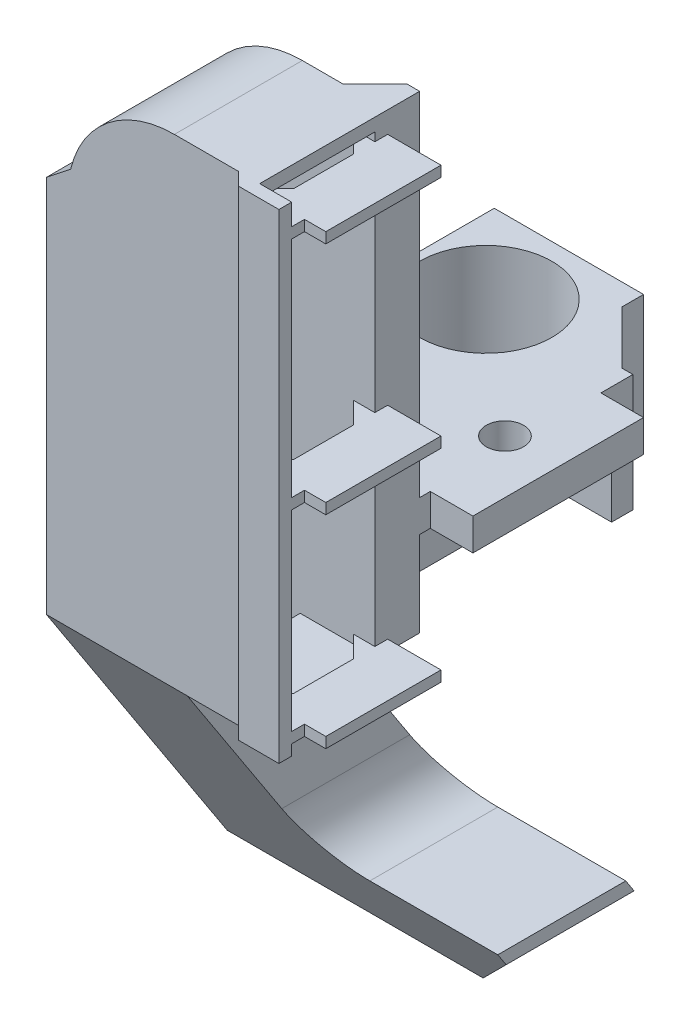
from build123d import *

# Parameters (mm, degrees)
BOSS_EXTRUDE1_DEPTH       = 12
SHELL1_T                  = -1.2
SHELL1_THICKNESS_2_FACE_W = 43.8
SHELL1_THICKNESS_2_FACE_H = 9.6
SHELL1_THICKNESS_2_DEPTH  = 5.8
SKETCH2_W                 = 9.6
SKETCH2_H                 = 42.6
CUT_EXTRUDE2_DEPTH        = 7
BOSS_EXTRUDE3_REACH       = 49.634
SKETCH3_W                 = 5
SKETCH3_H                 = 1
BOSS_EXTRUDE4_DEPTH       = 11.2
SHELL2_START              = -8.8
SHELL2_DEPTH              = 8.8
CUT_EXTRUDE3_REACH        = 50.88
FILLET1_R                 = 10
BOSS_EXTRUDE5_DEPTH       = 17
SKETCH7_W                 = 5
SKETCH7_H                 = 45
BOSS_EXTRUDE6_DEPTH       = 1.2
SKETCH8_W                 = 1.2
SKETCH8_H                 = 45
BOSS_EXTRUDE7_DEPTH       = 3
CHAMFER1_SIZE             = 1.2
CHAMFER2_SIZE             = 3
CHAMFER3_SIZE             = 2
SKETCH9_W                 = 1.2
SKETCH9_H                 = 45
CUT_EXTRUDE4_DEPTH        = 2
CUT_EXTRUDE6_REACH        = 58.138
BOSS_EXTRUDE10_DEPTH      = 12
CUT_EXTRUDE8_DEPTH        = 10
CUT_EXTRUDE9_REACH        = 50.002
SKETCH20_R                = 1.75
BOSS_EXTRUDE11_DEPTH      = 12
CUT_EXTRUDE10_REACH       = 53.723
SKETCH22_R                = 6.2
CHAMFER4_SIZE             = 5
BOSS_EXTRUDE12_DEPTH      = 2
CHAMFER6_SIZE             = 5
CHAMFER6_SIZE2            = 3.613034268
FILLET2_R                 = 5


# Read off the part's stored shape, not the designer's step: Shell2
# Some blends are built 0.0001 mm under size
with BuildPart() as part:
    # Sketch1 → Boss-Extrude1 (new body)
    with BuildSketch(Plane.XY):
        with BuildLine():
            Line((-10, 0), (-10, 35))
            ThreePointArc((-10, 35), (-7.071067812, 42.071067812), (0, 45))
            Line((0, 45), (8, 45))
            Line((8, 45), (8, 0))
            Line((8, 0), (0, 0))
            Line((0, 0), (-10, 0))
        make_face()
    extrude(amount=BOSS_EXTRUDE1_DEPTH)

    # Shell1
    shell1_openings = [part.faces().sort_by_distance(p)[0] for p in [
        (-1, 0, 6),
    ]]
    offset(amount=SHELL1_T, openings=shell1_openings, kind=Kind.INTERSECTION)

    # Shell1 thickness 2 face (on inner face of the shell) → Shell1 thickness 2 (add)
    with BuildSketch(Plane(origin=(6.8, 21.9, 6), x_dir=(0, 1, 0), z_dir=(1, 0, 0))):
        Rectangle(SHELL1_THICKNESS_2_FACE_W, SHELL1_THICKNESS_2_FACE_H)
    extrude(amount=-SHELL1_THICKNESS_2_DEPTH)

    # Sketch2 → Cut-Extrude2 (cut)
    with BuildSketch(Plane(origin=(8, 0, 0), x_dir=(0, 0, -1), z_dir=(1, 0, 0))):
        with Locations((-6, 22.5)):
            Rectangle(SKETCH2_W, SKETCH2_H)
    extrude(amount=-CUT_EXTRUDE2_DEPTH, mode=Mode.SUBTRACT)

    # Boss-Extrude3: up to this face of the body (flat: up to its plane)
    boss_extrude3_end = Plane(part.part.faces().sort_by_distance((-0.815853962, 21.94845022, 0))[0])
    # Sketch3 → Boss-Extrude3 (add, up to the picked face)
    with BuildSketch(Plane.XY.offset(12), mode=Mode.PRIVATE) as boss_extrude3_sk1:
        with Locations((10.5, 1.5)):
            Rectangle(SKETCH3_W, SKETCH3_H)
    boss_extrude3_tool1 = split(extrude(boss_extrude3_sk1.sketch, amount=-BOSS_EXTRUDE3_REACH, mode=Mode.PRIVATE), bisect_by=boss_extrude3_end, keep=Keep.BOTH, mode=Mode.PRIVATE)
    # Sketch3 → Boss-Extrude3 (add, up to the picked face)
    with BuildSketch(Plane.XY.offset(12), mode=Mode.PRIVATE) as boss_extrude3_sk2:
        with Locations((10.5, 42.5)):
            Rectangle(SKETCH3_W, SKETCH3_H)
    boss_extrude3_tool2 = split(extrude(boss_extrude3_sk2.sketch, amount=-BOSS_EXTRUDE3_REACH, mode=Mode.PRIVATE), bisect_by=boss_extrude3_end, keep=Keep.BOTH, mode=Mode.PRIVATE)
    # Sketch3 → Boss-Extrude3 (add, up to the picked face)
    with BuildSketch(Plane.XY.offset(12), mode=Mode.PRIVATE) as boss_extrude3_sk3:
        with Locations((10.5, 20.5)):
            Rectangle(SKETCH3_W, SKETCH3_H)
    boss_extrude3_tool3 = split(extrude(boss_extrude3_sk3.sketch, amount=-BOSS_EXTRUDE3_REACH, mode=Mode.PRIVATE), bisect_by=boss_extrude3_end, keep=Keep.BOTH, mode=Mode.PRIVATE)
    add(boss_extrude3_tool1.solids().sort_by(Axis((10.5, 1.5, 12), (0, 0, -1)))[0])
    add(boss_extrude3_tool2.solids().sort_by(Axis((10.5, 42.5, 12), (0, 0, -1)))[0])
    add(boss_extrude3_tool3.solids().sort_by(Axis((10.5, 20.5, 12), (0, 0, -1)))[0])

    # Sketch4 → Boss-Extrude4 (add)
    with BuildSketch(Plane.ZY.offset(10)):
        Polygon((0, 0), (-15, -23), (-15, -26), (-4.956521739, -26), (12, 0), align=None)
    extrude(amount=-BOSS_EXTRUDE4_DEPTH)

    # Shell2 outline → Shell2 (cut)
    with BuildSketch(Plane.YZ.offset(SHELL2_START)):
        Polygon((-24.8, -13.8), (-23.356724835, -13.8), (-0.356724835, 1.2), (0, 1.2), (0, 10.567353369), (-24.8, -5.606559675), align=None)
    extrude(amount=SHELL2_DEPTH, mode=Mode.SUBTRACT)

    # Sketch5 → Cut-Extrude3 (cut, up to next)
    with BuildSketch(Plane(origin=(1.2, 0, 0), x_dir=(0, 0, -1), z_dir=(1, 0, 0)), mode=Mode.PRIVATE) as cut_extrude3_sk1:
        Polygon((2.34569011, -19.8), (11.480396847, -19.8), (13.8, -23.356724835), (13.8, -24.8), (5.606559675, -24.8), align=None)
    cut_extrude3_tool1 = extrude(cut_extrude3_sk1.sketch, amount=-CUT_EXTRUDE3_REACH, mode=Mode.PRIVATE) & part.part
    add(cut_extrude3_tool1.solids().sort_by_distance((1.2, -22.269522, -8.459387))[0], mode=Mode.SUBTRACT)

    # Fillet1
    # the kernel refuses this fillet: 10 mm, written as the material it takes off along each edge
    with BuildSketch(Plane(origin=(-8.8, 0, 10.567353369), x_dir=(0, -0.8376105968305514, -0.5462677805592855), z_dir=(1, 0, 0))) as fillet1_piece_1:
        with BuildLine():
            CenterArc((1.837441188, -10), FILLET1_R, 90, 11.329607827)
            Line((-0.127087359, -0.194867283), (0, 0))
            Line((0, 0), (1.837441188, 0))
        make_face()
    extrude(amount=8.8, mode=Mode.SUBTRACT)

    # Sketch6 → Boss-Extrude5 (add)
    with BuildSketch(Plane(origin=(1.2, 0, 0), x_dir=(0, 0, -1), z_dir=(1, 0, 0))):
        Polygon((0.130434783, -18.6), (4.956521739, -26), (15, -26), (15, -23), (12.130434783, -18.6), align=None)
        Polygon((2.34569011, -19.8), (5.606559675, -24.8), (13.8, -24.8), (13.8, -23.356724835), (11.480396847, -19.8), align=None, mode=Mode.SUBTRACT)
    extrude(amount=BOSS_EXTRUDE5_DEPTH)

    # Sketch7 → Boss-Extrude6 (add)
    with BuildSketch(Plane.XY.offset(12)):
        with Locations((8.5, 22.5)):
            Rectangle(SKETCH7_W, SKETCH7_H)
    extrude(amount=BOSS_EXTRUDE6_DEPTH)

    # Sketch8 → Boss-Extrude7 (add)
    with BuildSketch(Plane(origin=(0, 0, 0), x_dir=(-1, 0, 0), z_dir=(0, 0, -1))):
        with Locations((-7.4, 22.5)):
            Rectangle(SKETCH8_W, SKETCH8_H)
    extrude(amount=BOSS_EXTRUDE7_DEPTH)

    # Chamfer1
    chamfer1_edges = [part.edges().sort_by_distance(p)[0] for p in [
        (6, 22.5, 13.2),
    ]]
    chamfer(chamfer1_edges, length=CHAMFER1_SIZE - 0.0001)  # a hair under: the kernel refuses the full size

    # Chamfer2
    chamfer2_edges = [part.edges().sort_by_distance(p)[0] for p in [
        (6.8, 22.5, 0),
    ]]
    chamfer(chamfer2_edges, length=CHAMFER2_SIZE - 0.0001)  # a hair under: the kernel refuses the full size

    # Chamfer3
    chamfer3_edges = [part.edges().sort_by_distance(p)[0] for p in [
        (8, 1.6, 1.2),
        (8, 1.6, 10.8),
        (8, 42.5, 1.2),
        (8, 42.5, 10.8),
        (8, 20.5, 1.2),
        (8, 20.5, 10.8),
    ]]
    chamfer(chamfer3_edges, length=CHAMFER3_SIZE)

    # Sketch9 → Cut-Extrude4 (cut)
    with BuildSketch(Plane(origin=(13, 0, 0), x_dir=(0, 0, -1), z_dir=(1, 0, 0))):
        with Locations((-11.4, 22.5)):
            Rectangle(SKETCH9_W, SKETCH9_H)
    extrude(amount=-CUT_EXTRUDE4_DEPTH, mode=Mode.SUBTRACT)

    # Sketch13 → Cut-Extrude6 (cut, up to next)
    with BuildSketch(Plane(origin=(0, 0, -15), x_dir=(-1, 0, 0), z_dir=(0, 0, -1)), mode=Mode.PRIVATE) as cut_extrude6_sk1:
        Polygon((-18.2, -19.8), (-12, -26), (-18.2, -26), align=None)
    cut_extrude6_tool1 = extrude(cut_extrude6_sk1.sketch, amount=-CUT_EXTRUDE6_REACH, mode=Mode.PRIVATE) & part.part
    add(cut_extrude6_tool1.solids().sort_by_distance((16.133333, -23.933333, -15))[0], mode=Mode.SUBTRACT)

    # Sketch18 → Boss-Extrude10 (add)
    with BuildSketch(Plane(origin=(0, 0, 0), x_dir=(1, 0, 0), z_dir=(0, 1, 0))):
        Polygon((8, 20), (8, 23), (-2, 23), (-2, 0), (8, 0), (8, 4), (12, 4), (12, 20), align=None)
    extrude(amount=BOSS_EXTRUDE10_DEPTH)

    # Sketch19 → Cut-Extrude8 (cut)
    with BuildSketch(Plane(origin=(12, 0, 0), x_dir=(0, 0, -1), z_dir=(1, 0, 0))):
        Polygon((21, 9), (3, 9), (3, 1), (1, 1), (1, 0), (23, 0), (23, 1), (21, 1), align=None)
    extrude(amount=-CUT_EXTRUDE8_DEPTH, mode=Mode.SUBTRACT)

    # Sketch20 → Cut-Extrude9 (cut, up to next)
    with BuildSketch(Plane(origin=(0, 12, 0), x_dir=(1, 0, 0), z_dir=(0, 1, 0)), mode=Mode.PRIVATE) as cut_extrude9_sk1:
        with Locations(Location((7, 12, 0), (0, 0, 270))):
            Circle(SKETCH20_R)
    cut_extrude9_tool1 = extrude(cut_extrude9_sk1.sketch, amount=-CUT_EXTRUDE9_REACH, mode=Mode.PRIVATE) & part.part
    add(cut_extrude9_tool1.solids().sort_by_distance((7, 12, -12))[0], mode=Mode.SUBTRACT)

    # Sketch21 → Boss-Extrude11 (add)
    with BuildSketch(Plane(origin=(0, 12, 0), x_dir=(1, 0, 0), z_dir=(0, 1, 0))):
        Polygon((2, 15), (-2, 15), (-2, 0), (-12, 0), (-12, 15), (-12, 30), (2, 30), align=None)
    extrude(amount=-BOSS_EXTRUDE11_DEPTH)

    # Sketch22 → Cut-Extrude10 (cut, up to next)
    with BuildSketch(Plane(origin=(0, 12, 0), x_dir=(1, 0, 0), z_dir=(0, 1, 0)), mode=Mode.PRIVATE) as cut_extrude10_sk1:
        with Locations(Location((-5, 22.2, 0), (0, 0, 270))):
            Circle(SKETCH22_R)
    cut_extrude10_tool1 = extrude(cut_extrude10_sk1.sketch, amount=-CUT_EXTRUDE10_REACH, mode=Mode.PRIVATE) & part.part
    add(cut_extrude10_tool1.solids().sort_by_distance((-5, 12, -22.2))[0], mode=Mode.SUBTRACT)

    # Chamfer4
    chamfer4_edges = [part.edges().sort_by_distance(p)[0] for p in [
        (2, 6.5, -23),
    ]]
    chamfer(chamfer4_edges, length=CHAMFER4_SIZE)

    # Sketch24 → Boss-Extrude12 (add)
    with BuildSketch(Plane.ZY.offset(10)):
        Polygon((-15, -26), (-4.956521739, -26), (12, 0), (12, 35), (0, 35), (0, 0), (-15, -23), align=None)
    extrude(amount=BOSS_EXTRUDE12_DEPTH)

    # Chamfer5
    # the kernel refuses this chamfer: 3 mm, written as the material it adds along each edge
    with BuildSketch(Plane(origin=(-10, 35, 0), x_dir=(0.15107271511055767, 0.9885226526231577, 0), z_dir=(0, 0, 1))) as chamfer5_piece_1_section:
        with BuildLine():
            Line((2.409770926, 0), (-0.487996367, 2.700518235))
            Line((-0.487996367, 2.700518235), (-0.547307726, 2.691453872))
            ThreePointArc((-0.547307726, 2.691453872), (-0.266526199, 1.346816234), (-0.059311359, -0.009064363))
            Line((-0.059311359, -0.009064363), (0.009064363, -0.059311359))
            ThreePointArc((0.009064363, -0.059311359), (1.203337899, 0.050019412), (2.404903392, -0.059802233))
            Line((2.404903392, -0.059802233), (2.409770926, 0))
        make_face()
    chamfer5_piece_1 = extrude(amount=12, mode=Mode.PRIVATE)
    chamfer5_piece_1 = split(chamfer5_piece_1, bisect_by=Plane(origin=(-12, 35.791311863, 6), z_dir=(1, 0, 0)), keep=Keep.TOP, mode=Mode.PRIVATE)
    add(chamfer5_piece_1)

    # Chamfer6
    chamfer6_edges = [part.edges().sort_by_distance(p)[0] for p in [
        (-5.4, 0, 0),
    ]]
    chamfer6_side = [part.faces().sort_by_distance(p)[0] for p in [
        (-2.663573131, 0, -7.819292495),
    ]]
    chamfer(chamfer6_edges, length=CHAMFER6_SIZE, length2=CHAMFER6_SIZE2, reference=chamfer6_side[0])

    # Fillet2
    # the kernel refuses this fillet: 5 mm, written as the material it adds along each edge
    with BuildSketch(Plane(origin=(1.2, -18.6, -24.630434783), x_dir=(1, 0, 0), z_dir=(0, 0, 1))) as fillet2_piece_1_section:
        with BuildLine():
            CenterArc((FILLET2_R, FILLET2_R), FILLET2_R, 180, 90)
            Line((0, FILLET2_R), (0, 0))
            Line((0, 0), (FILLET2_R, 0))
        make_face()
    fillet2_piece_1 = extrude(amount=37, mode=Mode.PRIVATE)
    fillet2_piece_1 = split(fillet2_piece_1, bisect_by=Plane(origin=(2.316839695, -20.228518395, -1.192511997), z_dir=(0, 0.5462677805469222, -0.8376105968386143)), keep=Keep.TOP, mode=Mode.PRIVATE)
    fillet2_piece_1 = split(fillet2_piece_1, bisect_by=Plane(origin=(2.316839695, -14.737802215, -9.61161014), z_dir=(0, -0.5462677805469223, 0.8376105968386143)), keep=Keep.TOP, mode=Mode.PRIVATE)
    add(fillet2_piece_1)
    with BuildSketch(Plane(origin=(-8.8, -24.8, 6.893440325), x_dir=(0, 1, 0), z_dir=(0, 0, -1))) as fillet2_piece_2_section:
        with BuildLine():
            CenterArc((FILLET2_R, FILLET2_R), FILLET2_R, 180, 90)
            Line((0, FILLET2_R), (0, 0))
            Line((0, 0), (FILLET2_R, 0))
        make_face()
    fillet2_piece_2 = extrude(amount=33.193440325, mode=Mode.PRIVATE)
    fillet2_piece_2 = split(fillet2_piece_2, bisect_by=Plane(origin=(-7.705272572, -26.311851744, -5.159903312), z_dir=(0, 0.5462677805469222, -0.8376105968386143)), keep=Keep.TOP, mode=Mode.PRIVATE)
    fillet2_piece_2 = split(fillet2_piece_2, bisect_by=Plane(origin=(-7.705272572, -23.651485488, -15), z_dir=(0, 0, 1)), keep=Keep.TOP, mode=Mode.PRIVATE)
    fillet2_piece_2 = split(fillet2_piece_2, bisect_by=Plane(origin=(-7.705272572, -20.821135564, -13.579001455), z_dir=(0, -0.5462677805469223, 0.8376105968386143)), keep=Keep.TOP, mode=Mode.PRIVATE)
    add(fillet2_piece_2)
    # the kernel refuses this fillet: 5 mm, written as the material it takes off along each edge
    with BuildSketch(Plane(origin=(0, -19.8, -23.980396847), x_dir=(1, 0, 0), z_dir=(0, 0, 1))) as fillet2_2_piece_1_section:
        with BuildLine():
            CenterArc((FILLET2_R, FILLET2_R), FILLET2_R, 180, 90)
            Line((0, FILLET2_R), (0, 0))
            Line((0, 0), (FILLET2_R, 0))
        make_face()
    fillet2_2_piece_1 = extrude(amount=34.134706737, mode=Mode.PRIVATE)
    fillet2_2_piece_1 = split(fillet2_2_piece_1, bisect_by=Plane(origin=(1.116839695, -20.772997059, -2.980253409), z_dir=(0, 0.5462677805469219, -0.8376105968386146)), keep=Keep.TOP, mode=Mode.PRIVATE)
    fillet2_2_piece_1 = split(fillet2_2_piece_1, bisect_by=Plane(origin=(1.116839695, -16.593323552, -9.38908612), z_dir=(0, -0.5462677805469225, 0.8376105968386142)), keep=Keep.TOP, mode=Mode.PRIVATE)
    add(fillet2_2_piece_1, mode=Mode.SUBTRACT)


solid = part.part
